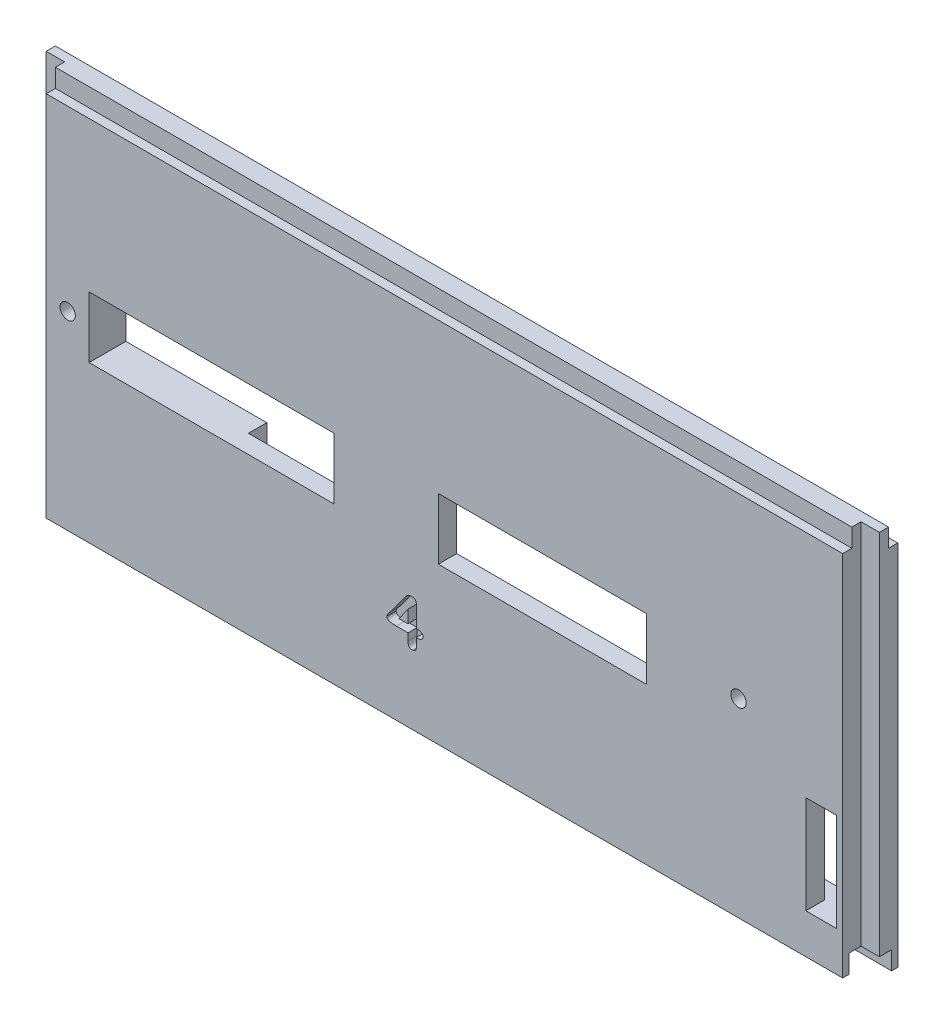
from build123d import *

# Parameters (mm, degrees)
SKETCH_1_W           = 130
SKETCH_1_H           = 60
EXTRUDE_1_DEPTH      = 6
EXTRUDE_2_DEPTH      = 3
EXTRUDE_2_DEPTH_BACK = 133
SKETCH_2_W           = 3
SKETCH_2_H           = 60
SKETCH_3_R           = 1.25
SKETCH_3_W           = 5
SKETCH_3_H           = 16
SKETCH_3_W_2         = 40
SKETCH_3_H_2         = 10
SKETCH_3_W_3         = 34
CUT_EXTRUDE_1_DEPTH  = 6
CUT_EXTRUDE_2_DEPTH  = 1.5
SKETCH_5_W           = 70
SKETCH_5_H           = 41.476582403
SKETCH_5_W_2         = 24
SKETCH_5_H_2         = 16
CUT_EXTRUDE_3_DEPTH  = 3
CHAMFER_1_SIZE       = 15
CHAMFER_1_SIZE_2     = 3
CUT_EXTRUDE_4_DEPTH  = 3
SKETCH_7_W           = 130
SKETCH_7_H           = 1.5
EXTRUDE_3_DEPTH      = 3


with BuildPart() as part:
    # 草圖1 → 填料-伸長1 (new body)
    with BuildSketch(Plane.XY):
        with Locations((11.111111111, -11.25)):
            Rectangle(SKETCH_1_W, SKETCH_1_H)
    extrude(amount=EXTRUDE_1_DEPTH)

    # 草圖2 → 填料-伸長2 (add, two sides: drawn at the far end of the back side and taken through both)
    with BuildSketch(Plane.ZY.offset(53.888888889).offset(-EXTRUDE_2_DEPTH_BACK)):
        with Locations((1.5, -11.25)):
            Rectangle(SKETCH_2_W, SKETCH_2_H)
    extrude(amount=EXTRUDE_2_DEPTH + EXTRUDE_2_DEPTH_BACK)

    # 草圖3 → 除料-伸長1 (cut)
    with BuildSketch(Plane.XY.offset(6)):
        with Locations((59.111111111, -10.25)):
            Circle(SKETCH_3_R)
        with Locations((-50.388888889, -10.25)):
            Circle(SKETCH_3_R)
        with Locations((72.611111111, -26.75)):
            Rectangle(SKETCH_3_W, SKETCH_3_H)
        with Locations((-26.888888889, -10.75)):
            Rectangle(SKETCH_3_W_2, SKETCH_3_H_2)
        with Locations((27.111111111, -10.75)):
            Rectangle(SKETCH_3_W_3, SKETCH_3_H_2)
    extrude(amount=-CUT_EXTRUDE_1_DEPTH, mode=Mode.SUBTRACT)

    # 草圖4 → 除料-伸長2 (cut)
    with BuildSketch(Plane.XY.offset(6)):
        with BuildLine():
            Line((5.161633763, -27.924686511), (3.254050898, -27.924686511))
            add(Edge.make_bspline(
                [(3.254050898, -27.924686511), (3.192249579, -27.924078509), (3.072379909, -27.922899232), (2.898729115, -27.915701709), (2.736761533, -27.904944526), (2.586564336, -27.888174414), (2.448251756, -27.865582926), (2.322097886, -27.838909636), (2.207853822, -27.808266207), (2.105836262, -27.771295953), (2.01510686, -27.730787239), (1.936069122, -27.68581143), (1.86982721, -27.634270004), (1.815766676, -27.57730265), (1.772168095, -27.516260775), (1.742170993, -27.449388735), (1.72280295, -27.378127045), (1.720982885, -27.328575874), (1.72005993, -27.303448471)],
                knots=[0, 0, 0, 0, 1.637449122, 3.175991815, 4.604285445, 5.937552174, 7.178588142, 8.315988927, 9.352959284, 10.309701018, 11.187868748, 11.983148269, 12.713194599, 13.402748524, 14.058038132, 14.690029686, 15.335713943, 16, 16, 16, 16], degree=3))
            add(Edge.make_bspline(
                [(1.72005993, -27.303448471), (1.723635689, -27.258199951), (1.731180344, -27.162728075), (1.787663263, -27.019644469), (1.87219849, -26.869087652), (1.94824443, -26.77316), (1.988932886, -26.721833814)],
                knots=[0, 0, 0, 0, 0.830703556, 1.752738595, 2.797600559, 4, 4, 4, 4], degree=3))
            add(Edge.make_bspline(
                [(1.988932886, -26.721833814), (2.063514276, -26.639331654), (2.213358857, -26.473573125), (2.362577426, -26.307250824), (2.437526185, -26.223711286)],
                knots=[0, 0, 0, 0, 0.995449954, 2, 2, 2, 2], degree=3))
            add(Edge.make_bspline(
                [(2.437526185, -26.223711286), (2.47103383, -26.177024109), (2.540031377, -26.080887817), (2.64617827, -25.932308493), (2.757969515, -25.7748922), (2.87632458, -25.60941735), (3.003450981, -25.437027126), (3.133736422, -25.254119028), (3.273689868, -25.064815864), (3.417008587, -24.865483968), (3.567026655, -24.658540826), (3.724948502, -24.444530992), (3.888719581, -24.221478696), (4.058065694, -23.989527198), (4.234458829, -23.749756028), (4.416012984, -23.500904526), (4.606300307, -23.245131026), (4.734336909, -23.071345188), (4.799362833, -22.983084609)],
                knots=[0, 0, 0, 0, 0.68787784, 1.416449417, 2.185717103, 2.998962895, 3.851631247, 4.749555124, 5.686911444, 6.669516273, 7.688234189, 8.746402434, 9.853137794, 11.000549032, 12.184081851, 13.416182313, 14.687757029, 16, 16, 16, 16], degree=3))
            add(Edge.make_bspline(
                [(4.799362833, -22.983084609), (4.830971294, -22.943553506), (4.892623413, -22.866448317), (4.999342936, -22.767074964), (5.111072502, -22.681126787), (5.230934533, -22.611368569), (5.358194037, -22.556625494), (5.493063713, -22.519613637), (5.634235505, -22.493643771), (5.730861536, -22.49164161), (5.780041561, -22.490622564)],
                knots=[0, 0, 0, 0, 1.06425237, 2.0758181, 3.06095989, 4.026690108, 4.987711416, 5.968488933, 6.966016048, 8, 8, 8, 8], degree=3))
            add(Edge.make_bspline(
                [(5.780041561, -22.490622564), (5.826442291, -22.491944732), (5.916313772, -22.494505581), (6.045628911, -22.523235489), (6.166636791, -22.565562498), (6.23827235, -22.610014837), (6.273918727, -22.632134646)],
                knots=[0, 0, 0, 0, 1.066082933, 2.064847948, 3.037054213, 4, 4, 4, 4], degree=3))
            add(Edge.make_bspline(
                [(6.273918727, -22.632134646), (6.311441096, -22.661555246), (6.384541176, -22.718871676), (6.465186438, -22.833465288), (6.511587665, -22.966478607), (6.517237732, -23.060547629), (6.52014975, -23.109030362)],
                knots=[0, 0, 0, 0, 1.018925786, 1.985044098, 2.961501162, 4, 4, 4, 4], degree=3))
            Line((6.52014975, -23.109030362), (6.52014975, -26.656738256))
            add(Edge.make_bspline(
                [(6.52014975, -26.656738256), (6.571120358, -26.658160603), (6.668428141, -26.660876), (6.807468472, -26.672045587), (6.933741535, -26.681782224), (7.04627481, -26.698396225), (7.146439706, -26.713806583), (7.232355911, -26.736203852), (7.306925886, -26.756584321), (7.349633605, -26.777387591), (7.369222241, -26.786929372)],
                knots=[0, 0, 0, 0, 1.415561033, 2.70244186, 3.872869685, 4.930574004, 5.860813375, 6.683597148, 7.396208987, 8, 8, 8, 8], degree=3))
            add(Edge.make_bspline(
                [(7.369222241, -26.786929372), (7.387933285, -26.798727315), (7.425308471, -26.82229363), (7.475291838, -26.865642335), (7.515332971, -26.918922636), (7.550217281, -26.978243638), (7.574189335, -27.047295447), (7.595611952, -27.122551217), (7.603742149, -27.206589411), (7.605862425, -27.264770318), (7.606962539, -27.294957746)],
                knots=[0, 0, 0, 0, 0.898852474, 1.795451925, 2.670043032, 3.597686986, 4.580760669, 5.631985542, 6.771344949, 8, 8, 8, 8], degree=3))
            add(Edge.make_bspline(
                [(7.606962539, -27.294957746), (7.6065918, -27.327130489), (7.605877096, -27.389152557), (7.587829145, -27.478153146), (7.560306222, -27.5599435), (7.518416649, -27.632950045), (7.464991439, -27.697675729), (7.400296134, -27.754477063), (7.324655873, -27.805253805), (7.267343492, -27.829851085), (7.237616005, -27.842609503)],
                knots=[0, 0, 0, 0, 1.087494211, 2.096452886, 3.061576041, 3.998924861, 4.929714891, 5.891658933, 6.906419893, 8, 8, 8, 8], degree=3))
            add(Edge.make_bspline(
                [(7.237616005, -27.842609503), (7.190336116, -27.858712295), (7.089569557, -27.893031811), (6.919845265, -27.915756431), (6.72799274, -27.93166309), (6.591892116, -27.927094657), (6.52014975, -27.924686511)],
                knots=[0, 0, 0, 0, 0.822901404, 1.753831169, 2.815982903, 4, 4, 4, 4], degree=3))
            add(Edge.make_bspline(
                [(6.52014975, -27.924686511), (6.52249173, -28.040722435), (6.52728009, -28.27796686), (6.525874109, -28.640744347), (6.523902436, -29.018132536), (6.518606285, -29.274244271), (6.515904387, -29.404902888)],
                knots=[0, 0, 0, 0, 0.940774337, 1.923485917, 2.940640271, 4, 4, 4, 4], degree=3))
            add(Edge.make_bspline(
                [(6.515904387, -29.404902888), (6.513253145, -29.446642645), (6.508069894, -29.528245001), (6.47349895, -29.644606371), (6.416416736, -29.749022953), (6.340813008, -29.84091244), (6.245918419, -29.915035809), (6.135823145, -29.970814241), (6.008973806, -30.001054572), (5.919815256, -30.005455315), (5.873439535, -30.007744357)],
                knots=[0, 0, 0, 0, 1.014791907, 1.983945634, 2.923310284, 3.892735559, 4.856647083, 5.831419924, 6.872015472, 8, 8, 8, 8], degree=3))
            add(Edge.make_bspline(
                [(5.873439535, -30.007744357), (5.815037496, -30.005688173), (5.704234702, -30.001787096), (5.550592692, -29.954784505), (5.418967159, -29.880845956), (5.316601579, -29.770806418), (5.237109991, -29.634349624), (5.185909967, -29.467148659), (5.160681119, -29.271746214), (5.161303076, -29.132326216), (5.161633763, -29.058198287)],
                knots=[0, 0, 0, 0, 1.02325021, 1.941353164, 2.796047092, 3.646386069, 4.549425683, 5.551115642, 6.69795776, 8, 8, 8, 8], degree=3))
            Line((5.161633763, -29.058198287), (5.161633763, -27.924686511))
        make_face()
        with BuildLine():
            add(Edge.make_bspline(
                [(5.161633763, -24.57368041), (5.119646014, -24.636412887), (5.031158393, -24.768619255), (4.891120499, -24.978124945), (4.731778952, -25.205824972), (4.560305824, -25.457296058), (4.369434267, -25.726531763), (4.166450797, -26.019598708), (3.9439664, -26.33065406), (3.791254445, -26.545837446), (3.712550044, -26.656738256)],
                knots=[0, 0, 0, 0, 0.713938416, 1.50459871, 2.383225934, 3.342268853, 4.38315458, 5.504445422, 6.71384576, 8, 8, 8, 8], degree=3))
            Line((3.712550044, -26.656738256), (5.161633763, -26.656738256))
            Line((5.161633763, -26.656738256), (5.161633763, -24.57368041))
        make_face(mode=Mode.SUBTRACT)
    extrude(amount=-CUT_EXTRUDE_2_DEPTH, mode=Mode.SUBTRACT)

    # 草圖5 → 除料-伸長3 (cut)
    with BuildSketch(Plane(origin=(0, 0, 0), x_dir=(-1, 0, 0), z_dir=(0, 0, -1))):
        with Locations((-11.111111111, -20.511708798)):
            Rectangle(SKETCH_5_W, SKETCH_5_H)
        with Locations((-58.111111111, -26.75)):
            Rectangle(SKETCH_5_W_2, SKETCH_5_H_2)
    extrude(amount=-CUT_EXTRUDE_3_DEPTH, mode=Mode.SUBTRACT)

    # 導角1
    # the kernel refuses this chamfer: 15, 3 mm, written as the material it takes off along each edge
    with BuildSketch(Plane(origin=(46.111111111, 0.226582403, 0), x_dir=(0, 0.9999715107910818, -0.00754835122404063), z_dir=(-1, 0, 0))) as chamfer_1_piece_1_section:
        Polygon((CHAMFER_1_SIZE * 0.999971510791, -CHAMFER_1_SIZE * 0.00754835122404), (-CHAMFER_1_SIZE_2 * 0.00754835122404, -CHAMFER_1_SIZE_2 * 0.999971510791), (0, 0), align=None)
    chamfer_1_piece_1 = extrude(amount=70, mode=Mode.PRIVATE)
    chamfer_1_piece_1 = split(chamfer_1_piece_1, bisect_by=Plane(origin=(11.111111111, 5.568156657, 3), z_dir=(0, 0, -1)), keep=Keep.TOP, mode=Mode.PRIVATE)
    add(chamfer_1_piece_1, mode=Mode.SUBTRACT)

    # 草圖6 → 除料-伸長4 (cut)
    with BuildSketch(Plane.XZ.offset(41.25)):
        Polygon((-53.888888889, 3), (-23.888888889, 3), (46.111111111, 3), (76.111111111, 3), (76.111111111, 5), (-53.888888889, 5), align=None)
        Polygon((-56.888888889, 3), (-56.888888889, 1), (-23.888888889, 1), (-23.888888889, 3), (-53.888888889, 3), align=None)
        Polygon((46.111111111, 3), (46.111111111, 1), (79.111111111, 1), (79.111111111, 3), (76.111111111, 3), align=None)
    extrude(amount=-CUT_EXTRUDE_4_DEPTH, mode=Mode.SUBTRACT)

    # 草圖7 → 填料-伸長3 (add)
    with BuildSketch(Plane(origin=(0, 18.75, 0), x_dir=(1, 0, 0), z_dir=(0, 1, 0))):
        Polygon((79.111111111, -1.5), (-56.888888889, -1.5), (-56.888888889, -3), (-53.888888889, -3), (76.111111111, -3), (79.111111111, -3), align=None)
        with Locations((11.111111111, -3.75)):
            Rectangle(SKETCH_7_W, SKETCH_7_H)
    extrude(amount=EXTRUDE_3_DEPTH)


solid = part.part
